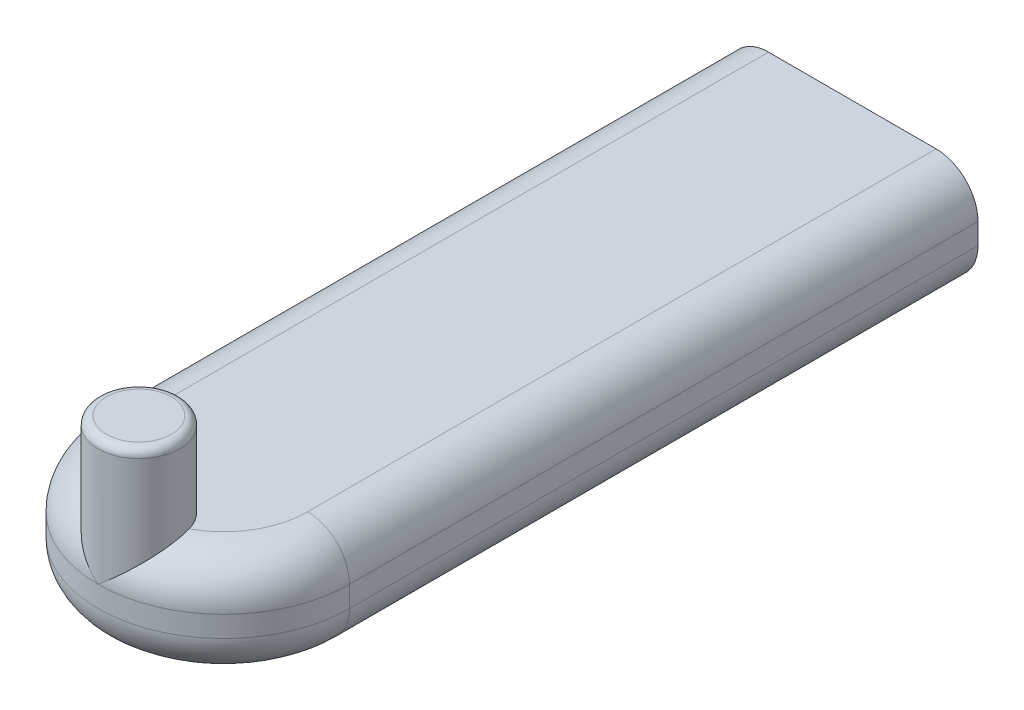
from build123d import *

# Parameters (mm, degrees)
BOSS_EXTRUDE1_DEPTH = 5
SKETCH2_R           = 1.95
CUT_EXTRUDE1_DEPTH  = 8
SKETCH3_R           = 1.95
BOSS_EXTRUDE2_DEPTH = 4
FILLET2_START       = -1e-07
FILLET2_OUTLINE_W   = 12
FILLET2_OUTLINE_H   = 5
FILLET2_DEPTH       = 6.0000001
FILLET2_START_2     = -31
FILLET2_2_DEPTH     = 32.804913921
FILLET2_START_3     = 2
FILLET2_3_DEPTH     = 0.9999999
FILLET2_4_OUTLINE_R = 1.95
FILLET2_4_DEPTH     = 3
FILLET3_R           = 0.4


with BuildPart() as part:
    # Sketch1 → Boss-Extrude1 (new body)
    with BuildSketch(Plane(origin=(0, 0, 0), x_dir=(1, 0, 0), z_dir=(0, 1, 0))):
        with BuildLine():
            Line((-6, 0), (-6, 30))
            Line((-6, 30), (6, 30))
            Line((6, 30), (6, 0))
            ThreePointArc((6, 0), (0, -6), (-6, 0))
        make_face()
    extrude(amount=BOSS_EXTRUDE1_DEPTH)

    # Sketch2 → Cut-Extrude1 (cut)
    with BuildSketch(Plane(origin=(0, 0, -30), x_dir=(-1, 0, 0), z_dir=(0, 0, -1))):
        with Locations((0, 2.5)):
            Circle(SKETCH2_R)
    extrude(amount=-CUT_EXTRUDE1_DEPTH, mode=Mode.SUBTRACT)

    # Sketch3 → Boss-Extrude2 (add)
    with BuildSketch(Plane(origin=(0, 5, 0), x_dir=(1, 0, 0), z_dir=(0, 1, 0))):
        with Locations(Location((0, -4.05, 0), (0, 0, 269.999293734))):
            Circle(SKETCH3_R)
    extrude(amount=BOSS_EXTRUDE2_DEPTH)

    # Fillet2: read off the stored shape, not the designer's step
    # Fillet2 outline → Fillet2 (cut)
    with BuildSketch(Plane.XY.offset(FILLET2_START)):
        with Locations((0, 2.5)):
            Rectangle(FILLET2_OUTLINE_W, FILLET2_OUTLINE_H)
    extrude(amount=FILLET2_DEPTH, mode=Mode.SUBTRACT)

    # Fillet2 2 outline → Fillet2 2 (cut)
    with BuildSketch(Plane.XY.offset(FILLET2_START_2)):
        with BuildLine():
            ThreePointArc((-4, 0), (-5.414213562, 0.585786438), (-6, 2))
            Line((-6, 2), (-6, 0))
            Line((-6, 0), (-4, 0))
        make_face()
        with BuildLine():
            Line((-6, 5), (-6, 3))
            ThreePointArc((-6, 3), (-5.414213562, 4.414213562), (-4, 5))
            Line((-4, 5), (-6, 5))
        make_face()
        with BuildLine():
            ThreePointArc((6, 2), (5.414213562, 0.585786438), (4, 0))
            Line((4, 0), (6, 0))
            Line((6, 0), (6, 2))
        make_face()
        with BuildLine():
            Line((6, 5), (4, 5))
            ThreePointArc((4, 5), (5.414213562, 4.414213562), (6, 3))
            Line((6, 3), (6, 5))
        make_face()
    extrude(amount=FILLET2_2_DEPTH, mode=Mode.SUBTRACT)

    # Fillet2 3 outline → Fillet2 3 (add)
    with BuildSketch(Plane(origin=(0, 0, 0), x_dir=(1, 0, 0), z_dir=(0, 1, 0)).offset(FILLET2_START_3)):
        with BuildLine():
            Line((6, 5e-08), (-6, 5e-08))
            ThreePointArc((-6, 5e-08), (0, -6), (6, 5e-08))
        make_face()
    extrude(amount=FILLET2_3_DEPTH)

    # Fillet2 4 outline → Fillet2 4 (add)
    with BuildSketch(Plane(origin=(0, 0, 0), x_dir=(1, 0, 0), z_dir=(0, 1, 0)).offset(FILLET2_START_3)):
        with Locations((0, -4.05)):
            Circle(FILLET2_4_OUTLINE_R)
    extrude(amount=FILLET2_4_DEPTH)

    # Fillet2 5 outline → Fillet2 5 (revolve)
    with BuildSketch(Plane.XY):
        with BuildLine():
            Line((4, 5), (0, 5))
            Line((0, 5), (0, 2.9999999))
            Line((0, 2.9999999), (6, 3))
            ThreePointArc((6, 3), (5.414213562, 4.414213562), (4, 5))
        make_face()
        with BuildLine():
            Line((0, 2), (0, 0))
            Line((0, 0), (4, 0))
            ThreePointArc((4, 0), (5.414213562, 0.585786438), (6, 2))
            Line((6, 2), (0, 2))
        make_face()
    revolve(axis=Axis((0, 0, 0), (0, 1, 0)))

    # Fillet3
    # the kernel refuses this fillet: 0.4 mm, written as the material it takes off along each edge
    with BuildSketch(Plane(origin=(0, 9, 4.05), x_dir=(-1.2326667094924345e-05, 0, 0.9999999999240267), z_dir=(-0.9999999999240267, 0, -1.2326667094924345e-05))) as fillet3_piece_1:
        with BuildLine():
            CenterArc((1.95 - FILLET3_R, -FILLET3_R), FILLET3_R, 0, 90)
            Line((1.95 - FILLET3_R, 0), (1.95, 0))
            Line((1.95, 0), (1.95, -FILLET3_R))
        make_face()
    revolve(axis=Axis((0, 9, 4.05), (0, 1, 0)), mode=Mode.SUBTRACT)


solid = part.part
